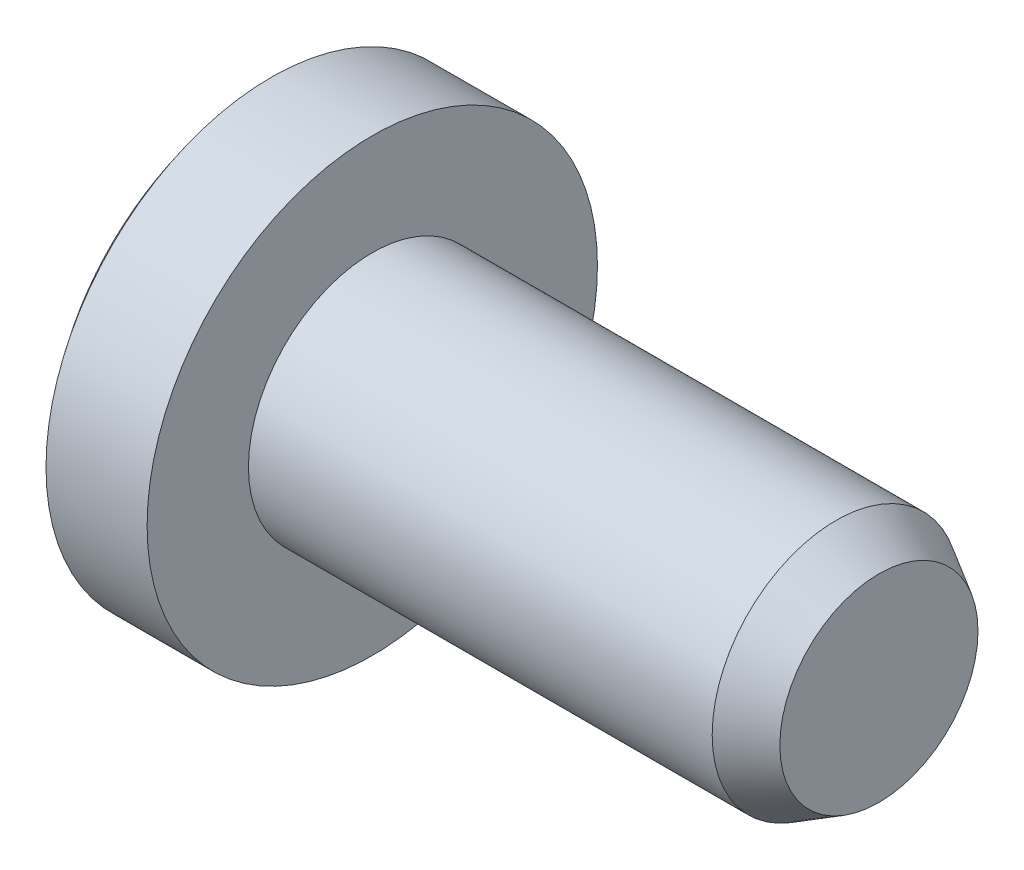
from build123d import *

# Parameters (mm, degrees)
CHAMFER1_SIZE      = 0.22
CHAMFER1_SIZE2     = 0.381051178
CUT_EXTRUDE1_DEPTH = 0.8
CUT_EXTRUDE1_TAPER = 6


with BuildPart() as part:
    # Sketch1 → Revolve1 (revolve)
    with BuildSketch(Plane.XY):
        with BuildLine():
            Line((0, 2), (-0.897999199, 2))
            ThreePointArc((-0.897999199, 2), (-1.419403703, 1.059811908), (-1.6, 0))
            Line((-1.6, 0), (4.5, 0))
            Line((4.5, 0), (4.5, 1.1))
            Line((4.5, 1.1), (0, 1.1))
            Line((0, 1.1), (0, 2))
        make_face()
    revolve(axis=Axis((0, 0, 0), (1, 0, 0)))

    # Chamfer1
    chamfer1_edges = [part.edges().sort_by_distance(p)[0] for p in [
        (4.5, -1.1, 0),
    ]]
    chamfer1_side = [part.faces().sort_by_distance(p)[0] for p in [
        (4.5, 0, 0),
    ]]
    chamfer(chamfer1_edges, length=CHAMFER1_SIZE, length2=CHAMFER1_SIZE2, reference=chamfer1_side[0])

    # Sketch3 → Cut-Extrude1 (cut)
    with BuildSketch(Plane(origin=(-1.6, 0, 0), x_dir=(0, 0, -1), z_dir=(1, 0, 0))):
        Polygon((-0.2375, 0.95), (-0.1425, 0.57), (-0.29897586, 0.29897586), (-0.57, 0.1425), (-0.95, 0.2375), (-0.95, -0.2375), (-0.57, -0.1425), (-0.29897586, -0.29897586), (-0.1425, -0.57), (-0.2375, -0.95), (0.2375, -0.95), (0.1425, -0.57), (0.29897586, -0.29897586), (0.57, -0.1425), (0.95, -0.2375), (0.95, 0.2375), (0.57, 0.1425), (0.29897586, 0.29897586), (0.1425, 0.57), (0.2375, 0.95), align=None)
    extrude(amount=CUT_EXTRUDE1_DEPTH, taper=CUT_EXTRUDE1_TAPER, mode=Mode.SUBTRACT)


solid = part.part
